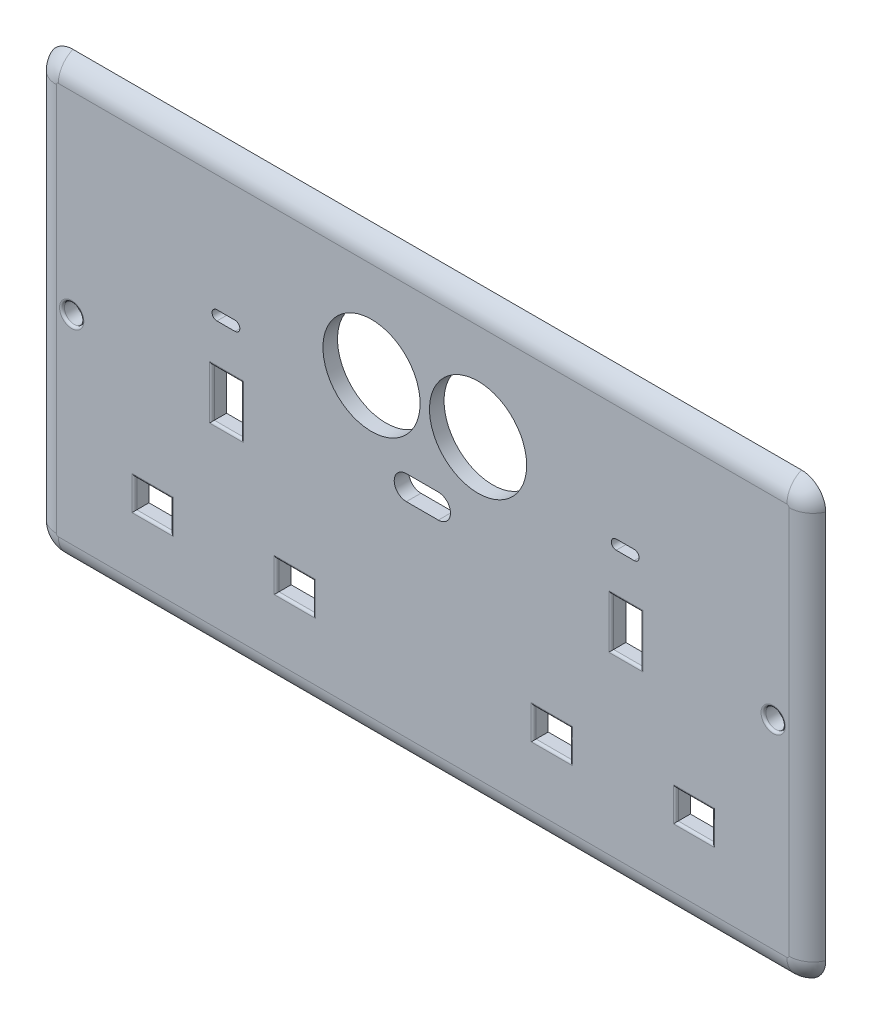
from build123d import *

# Parameters (mm, degrees)
SKETCH1_W           = 160
SKETCH1_H           = 90
BOSS_EXTRUDE8_DEPTH = 3
FILLET15_R          = 5
FILLET16_R          = 5
SKETCH14_R          = 10
SKETCH14_R_2        = 2
SKETCH14_W          = 7.5
SKETCH14_H          = 6
SKETCH14_W_2        = 6
SKETCH14_H_2        = 10
CUT_EXTRUDE1_DEPTH  = 3
FILLET17_R          = 0.5


with BuildPart() as part:
    # Sketch1 → Boss-Extrude8 (new body)
    with BuildSketch(Plane.XY):
        with Locations((-31.627906977, -65.930232558)):
            Rectangle(SKETCH1_W, SKETCH1_H)
    extrude(amount=BOSS_EXTRUDE8_DEPTH)

    # Fillet15
    fillet15_edges = [part.edges().sort_by_distance(p)[0] for p in [
        (-111.627906977, -20.930232558, 1.5),
        (48.372093023, -20.930232558, 1.5),
        (48.372093023, -110.930232558, 1.5),
        (-111.627906977, -110.930232558, 1.5),
    ]]
    fillet(fillet15_edges, radius=FILLET15_R)

    # Fillet16
    # the kernel refuses this fillet: 5 mm, written as the material it takes off along each edge
    with BuildSketch(Plane(origin=(-106.627906977, -25.930232558, 3), x_dir=(0, 1, 0), z_dir=(1, 0, 0))) as fillet16_piece_1:
        with BuildLine():
            CenterArc((0.417424305, -5), FILLET16_R, 23.578178478, 66.421821522)
            Line((0.417424305, 0), (0.417424305, 0.1))
            Line((0.417424305, 0.1), (5, 0.1))
            Line((5, 0.1), (5.1, 0))
            ThreePointArc((5.1, 0), (5.1, -1.5), (5.091651514, -2.96))
            Line((5.091651514, -2.96), (5, -3))
        make_face()
    revolve(axis=Axis((-106.627906977, -25.930232558, 3), (0, 0, 1)), revolution_arc=90, mode=Mode.SUBTRACT)
    with BuildSketch(Plane(origin=(-106.627906977, -20.930232558, 3), x_dir=(0, 0, -1), z_dir=(1, 0, 0))) as fillet16_piece_2:
        with BuildLine():
            CenterArc((5, -4.582575695), FILLET16_R, 113.578178478, 66.421821522)
            Line((0, -4.582575695), (-0.1, -4.582575695))
            Line((-0.1, -4.582575695), (-0.1, 0))
            Line((-0.1, 0), (0, 0.1))
            ThreePointArc((0, 0.1), (1.5, 0.1), (2.96, 0.091651514))
            Line((2.96, 0.091651514), (3, 0))
        make_face()
    extrude(amount=150, mode=Mode.SUBTRACT)
    with BuildSketch(Plane(origin=(43.372093023, -25.930232558, 3), x_dir=(0, 1, 0), z_dir=(-1, 0, 0))) as fillet16_piece_3:
        with BuildLine():
            CenterArc((0.417424305, 5), FILLET16_R, 270, 66.421821522)
            Line((0.417424305, 0), (0.417424305, -0.1))
            Line((0.417424305, -0.1), (5, -0.1))
            Line((5, -0.1), (5.1, 0))
            ThreePointArc((5.1, 0), (5.1, 1.5), (5.091651514, 2.96))
            Line((5.091651514, 2.96), (5, 3))
        make_face()
    revolve(axis=Axis((43.372093023, -25.930232558, 3), (0, 0, -1)), revolution_arc=90, mode=Mode.SUBTRACT)
    with BuildSketch(Plane(origin=(48.372093023, -25.930232558, 3), x_dir=(-1, 0, 0), z_dir=(0, -1, 0)), Plane(origin=(-111.627906977, -105.930232558, 3), x_dir=(1, 0, 0), z_dir=(0, 1, 0))) as fillet16_piece_4:
        with BuildLine():
            CenterArc((4.582575695, 5), FILLET16_R, 203.578178478, 66.421821522)
            Line((0, 3), (-0.091651514, 2.96))
            ThreePointArc((-0.091651514, 2.96), (-0.1, 1.5), (-0.1, 0))
            Line((-0.1, 0), (0, -0.1))
            Line((0, -0.1), (4.582575695, -0.1))
            Line((4.582575695, -0.1), (4.582575695, 0))
        make_face()
    extrude(amount=80, mode=Mode.SUBTRACT)
    with BuildSketch(Plane(origin=(43.372093023, -105.930232558, 3), x_dir=(1, 0, 0), z_dir=(0, 1, 0))) as fillet16_piece_5:
        with BuildLine():
            CenterArc((0.417424305, 5), FILLET16_R, 270, 66.421821522)
            Line((5, 3), (5.091651514, 2.96))
            ThreePointArc((5.091651514, 2.96), (5.1, 1.5), (5.1, 0))
            Line((5.1, 0), (5, -0.1))
            Line((5, -0.1), (0.417424305, -0.1))
            Line((0.417424305, -0.1), (0.417424305, 0))
        make_face()
    revolve(axis=Axis((43.372093023, -105.930232558, 3), (0, 0, -1)), revolution_arc=90, mode=Mode.SUBTRACT)
    with BuildSketch(Plane(origin=(43.372093023, -110.930232558, 3), x_dir=(0, 1, 0), z_dir=(-1, 0, 0))) as fillet16_piece_6:
        with BuildLine():
            CenterArc((4.582575695, 5), FILLET16_R, 203.578178478, 66.421821522)
            Line((0, 3), (-0.091651514, 2.96))
            ThreePointArc((-0.091651514, 2.96), (-0.1, 1.5), (-0.1, 0))
            Line((-0.1, 0), (0, -0.1))
            Line((0, -0.1), (4.582575695, -0.1))
            Line((4.582575695, -0.1), (4.582575695, 0))
        make_face()
    extrude(amount=150, mode=Mode.SUBTRACT)
    with BuildSketch(Plane(origin=(-106.627906977, -105.930232558, 3), x_dir=(0, -1, 0), z_dir=(1, 0, 0))) as fillet16_piece_7:
        with BuildLine():
            CenterArc((0.417424305, 5), FILLET16_R, 270, 66.421821522)
            Line((5, 3), (5.091651514, 2.96))
            ThreePointArc((5.091651514, 2.96), (5.1, 1.5), (5.1, 0))
            Line((5.1, 0), (5, -0.1))
            Line((5, -0.1), (0.417424305, -0.1))
            Line((0.417424305, -0.1), (0.417424305, 0))
        make_face()
    revolve(axis=Axis((-106.627906977, -105.930232558, 3), (0, 0, -1)), revolution_arc=90, mode=Mode.SUBTRACT)

    # Sketch14 → Cut-Extrude1 (cut)
    with BuildSketch(Plane.XY.offset(3)):
        with Locations((-42.146770789, -45.341082591)):
            Circle(SKETCH14_R)
        with Locations((-103.87862187, -65.341099016)):
            Circle(SKETCH14_R_2)
        with Locations((40.552517345, -65.341099016)):
            Circle(SKETCH14_R_2)
        with Locations((-20.211230278, -45.387431922)):
            Circle(SKETCH14_R)
        with Locations((-57.943307222, -90.939107411)):
            Rectangle(SKETCH14_W, SKETCH14_H)
        with Locations((-71.994996652, -65.002222921)):
            Rectangle(SKETCH14_W_2, SKETCH14_H_2)
        with Locations((-87.217465232, -90.960925791)):
            Rectangle(SKETCH14_W, SKETCH14_H)
        with BuildLine():
            Line((-73.975530372, -49.539987585), (-70.259376522, -49.539987585))
            ThreePointArc((-70.259376522, -49.539987585), (-69.259376522, -50.539987585), (-70.259376522, -51.539987585))
            Line((-70.259376522, -51.539987585), (-73.975530372, -51.539987585))
            ThreePointArc((-73.975530372, -51.539987585), (-74.975530372, -50.539987585), (-73.975530372, -49.539987585))
        make_face()
        with Locations((24.261172399, -90.711648075)):
            Rectangle(SKETCH14_W, SKETCH14_H)
        with Locations((10.209482969, -64.774763585)):
            Rectangle(SKETCH14_W_2, SKETCH14_H_2)
        with Locations((-5.012985611, -90.733466455)):
            Rectangle(SKETCH14_W, SKETCH14_H)
        with BuildLine():
            Line((8.228949249, -49.312528249), (11.945103099, -49.312528249))
            ThreePointArc((11.945103099, -49.312528249), (12.945103099, -50.312528249), (11.945103099, -51.312528249))
            Line((11.945103099, -51.312528249), (8.228949249, -51.312528249))
            ThreePointArc((8.228949249, -51.312528249), (7.228949249, -50.312528249), (8.228949249, -49.312528249))
        make_face()
        with BuildLine():
            Line((-34.976059895, -59.255469081), (-28.389202639, -59.255469081))
            ThreePointArc((-28.389202639, -59.255469081), (-25.889202639, -61.755469081), (-28.389202639, -64.255469081))
            Line((-28.389202639, -64.255469081), (-34.976059895, -64.255469081))
            ThreePointArc((-34.976059895, -64.255469081), (-37.476059895, -61.755469081), (-34.976059895, -59.255469081))
        make_face()
    extrude(amount=-CUT_EXTRUDE1_DEPTH, mode=Mode.SUBTRACT)

    # Fillet17
    fillet17_edges = [part.edges().sort_by_distance(p)[0] for p in [
        (20.511172399, -90.711648075, 3),
        (24.261172399, -93.711648075, 3),
        (28.011172399, -90.711648075, 3),
        (24.261172399, -87.711648075, 3),
        (-8.762985611, -90.733466455, 3),
        (-5.012985611, -93.733466455, 3),
        (-1.262985611, -90.733466455, 3),
        (-5.012985611, -87.733466455, 3),
        (7.209482969, -64.774763585, 3),
        (10.209482969, -69.774763585, 3),
        (13.209482969, -64.774763585, 3),
        (10.209482969, -59.774763585, 3),
        (-61.693307222, -90.939107411, 3),
        (-57.943307222, -93.939107411, 3),
        (-54.193307222, -90.939107411, 3),
        (-57.943307222, -87.939107411, 3),
        (-90.967465232, -90.960925791, 3),
        (-87.217465232, -93.960925791, 3),
        (-83.467465232, -90.960925791, 3),
        (-87.217465232, -87.960925791, 3),
        (38.552517345, -65.341099016, 3),
        (-105.87862187, -65.341099016, 3),
        (-74.994996652, -65.002222921, 3),
        (-71.994996652, -70.002222921, 3),
        (-68.994996652, -65.002222921, 3),
        (-71.994996652, -60.002222921, 3),
    ]]
    fillet(fillet17_edges, radius=FILLET17_R)


solid = part.part
